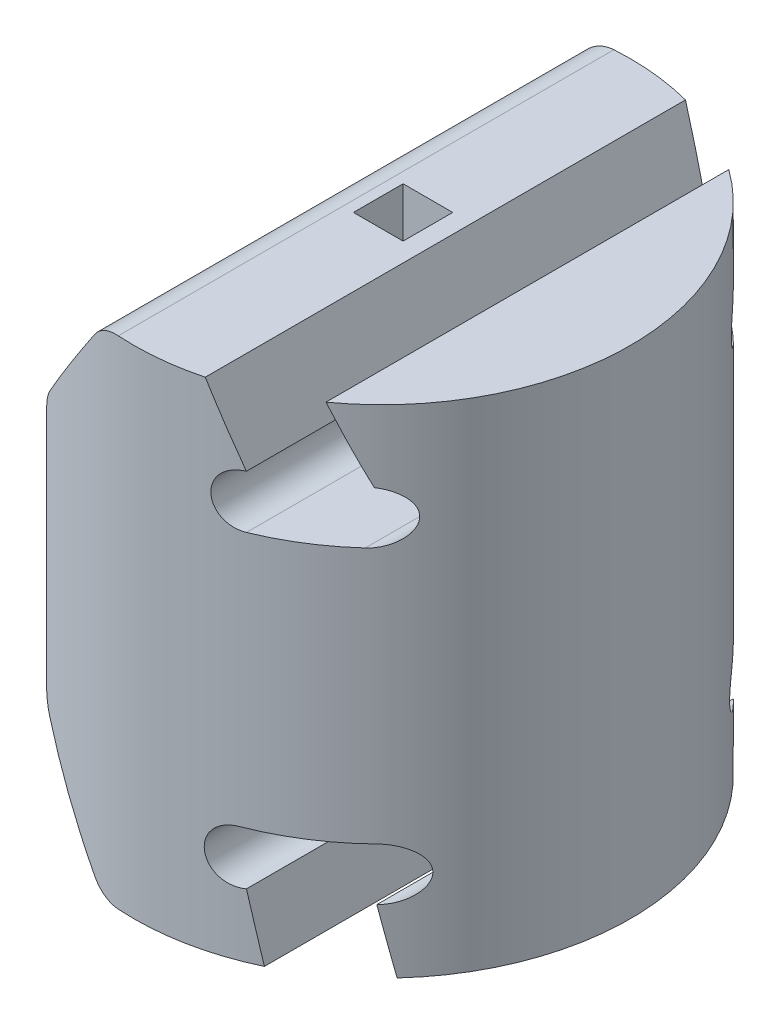
from build123d import *

# Parameters (mm, degrees)
SKETCH1_W               = 7.5
SKETCH1_H               = 15
CUT_EXTRUDE1_START      = -20
CUT_EXTRUDE1_DEPTH      = 20
SKETCH4_W               = 1.5
SKETCH4_H               = 1.5
CUT_EXTRUDE2_DEPTH      = 20
CUT_EXTRUDE3_DEPTH      = 17.075914552
CUT_EXTRUDE3_DEPTH_BACK = 17.075914552
CUT_EXTRUDE4_DEPTH      = 17.075914721
CUT_EXTRUDE4_DEPTH_BACK = 17.075914721
SKETCH8_W               = 12.380653288
SKETCH8_H               = 7.175906378
CUT_EXTRUDE5_DEPTH      = 0.5
FILLET2_R               = 1
FILLET5_R               = 0.5


with BuildPart() as part:
    # Sketch1 → Revolve1 (revolve)
    with BuildSketch(Plane.XY):
        with Locations((-3.75, 4.580357143)):
            Rectangle(SKETCH1_W, SKETCH1_H)
    revolve(axis=Axis((0, 12.080357143, 0), (0, -1, 0)))

    # Sketch2 → Cut-Extrude1 (cut)
    with BuildSketch(Plane.XZ.offset(2.919642857).offset(CUT_EXTRUDE1_START)):
        with BuildLine():
            Line((-3.5, 6.633249581), (-3.5, -6.633249581))
            ThreePointArc((-3.5, -6.633249581), (-7.5, 0), (-3.5, 6.633249581))
        make_face()
    extrude(amount=CUT_EXTRUDE1_DEPTH, mode=Mode.SUBTRACT)

    # Sketch4 → Cut-Extrude2 (cut)
    with BuildSketch(Plane.XZ.offset(2.919642857)):
        with Locations((0.588025285, -0.043999564)):
            Rectangle(SKETCH4_W, SKETCH4_H)
    extrude(amount=-CUT_EXTRUDE2_DEPTH, mode=Mode.SUBTRACT)

    # Sketch6 → Cut-Extrude3 (cut, two sides: drawn at the far end of the back side and taken through both)
    with BuildSketch(Plane.XY.offset(-CUT_EXTRUDE3_DEPTH_BACK)):
        with BuildLine():
            Line((2.684394406, 0.589840789), (5.221333223, 0.589840789))
            ThreePointArc((5.221333223, 0.589840789), (6.01349632, -0.202322309), (5.221333223, -0.994485407))
            Line((5.221333223, -0.994485407), (5.524196013, -2.919642857))
            Line((5.524196013, -2.919642857), (3.217926739, -2.919642857))
            Line((3.217926739, -2.919642857), (2.84197746, -0.994485407))
            ThreePointArc((2.84197746, -0.994485407), (2.755326831, -1.007008376), (2.667826658, -1.009987637))
            ThreePointArc((2.667826658, -1.009987637), (1.8844373, -0.201874894), (2.684394406, 0.589840789))
        make_face()
        with BuildLine():
            Line((2.84197746, 8.328542626), (5.04197746, 8.328542626))
            ThreePointArc((5.04197746, 8.328542626), (5.761372587, 8.781718764), (5.663273755, 9.626274613))
            ThreePointArc((5.663273755, 9.626274613), (5.448979722, 9.81206297), (5.183221531, 9.91111765))
            Line((5.183221531, 9.91111765), (4.385819176, 12.080357143))
            Line((4.385819176, 12.080357143), (1.90930103, 12.080357143))
            Line((1.90930103, 12.080357143), (2.840116682, 9.928540462))
            ThreePointArc((2.840116682, 9.928540462), (2.515101589, 9.858715321), (2.24652895, 9.662809481))
            ThreePointArc((2.24652895, 9.662809481), (2.111425106, 8.802516157), (2.84197746, 8.328542626))
        make_face()
    extrude(amount=CUT_EXTRUDE3_DEPTH + CUT_EXTRUDE3_DEPTH_BACK, mode=Mode.SUBTRACT)

    # Sketch7 → Cut-Extrude4 (cut, two sides: drawn at the far end of the back side and taken through both)
    with BuildSketch(Plane.XY.offset(-CUT_EXTRUDE4_DEPTH_BACK)):
        Polygon((-3.5, 0.600357143), (-3.5, -2.919642857), (-1, -2.919642857), align=None)
        Polygon((-3.5, 12.080357143), (-3.5, 8.580357143), (-1, 12.080357143), align=None)
    extrude(amount=CUT_EXTRUDE4_DEPTH + CUT_EXTRUDE4_DEPTH_BACK, mode=Mode.SUBTRACT)

    # Sketch8 → Cut-Extrude5 (cut)
    with BuildSketch(Plane.ZY.offset(3.5)):
        with Locations((-0.033221789, 4.583246246)):
            Rectangle(SKETCH8_W, SKETCH8_H)
    extrude(amount=-CUT_EXTRUDE5_DEPTH, mode=Mode.SUBTRACT)

    # Fillet2
    fillet2_edges = [part.edges().sort_by_distance(p)[0] for p in [
        (-1, 12.080357143, 0),
        (-3.5, 8.580357143, 0),
        (-1, -2.919642857, 0),
        (-3.5, 0.600357143, 0),
    ]]
    fillet(fillet2_edges, radius=FILLET2_R)

    # Fillet5
    # the kernel refuses this fillet: 0.5 mm, written as the material it takes off along each edge
    with BuildSketch(Plane(origin=(-3.5, 8.171199435, 6.157104855), x_dir=(0, 0, 1), z_dir=(0, -1, 0)), Plane(origin=(-3.5, 0.995293057, -6.223548433), x_dir=(0, 0, -1), z_dir=(0, 1, 0))) as fillet5_piece_1:
        with BuildLine():
            CenterArc((FILLET5_R, -FILLET5_R), FILLET5_R, 90, 90)
            Line((0, -FILLET5_R), (0, 0))
            Line((0, 0), (FILLET5_R, 0))
        make_face()
    extrude(amount=7.175906378, mode=Mode.SUBTRACT)


solid = part.part
